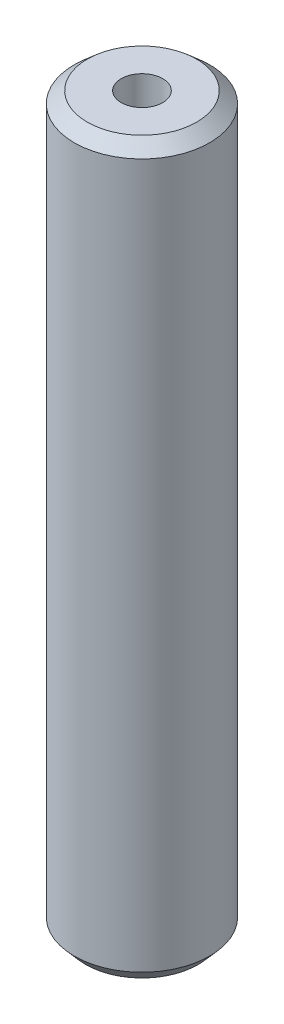
from build123d import *
from OCP.BRepFilletAPI import BRepFilletAPI_MakeChamfer

# Parameters (mm, degrees)
SKETCH1_R           = 20
BOSS_EXTRUDE1_DEPTH = 215.390074645
SKETCH2_R           = 6.141304551
CUT_EXTRUDE1_DEPTH  = 218.239232772
CHAMFER1_SIZE       = 3.356823599
CHAMFER1_SIZE2      = 3.842866654


with BuildPart() as part:
    # Sketch1 → Boss-Extrude1 (new body)
    with BuildSketch(Plane(origin=(0, 0, 0), x_dir=(1, 0, 0), z_dir=(0, 1, 0))):
        Circle(SKETCH1_R)
    extrude(amount=BOSS_EXTRUDE1_DEPTH)

    # Sketch2 → Cut-Extrude1 (cut, through all)
    with BuildSketch(Plane(origin=(0, 0, 0), x_dir=(1, 0, 0), z_dir=(0, 1, 0))):
        Circle(SKETCH2_R)
    extrude(amount=CUT_EXTRUDE1_DEPTH, mode=Mode.SUBTRACT)

    # Chamfer1: one chamfer whose edges measure the first distance from different faces: ONE call of the kernel's chamfer builder (chamfer() names one face for all edges)
    chamfer1_edges_1 = [part.edges().sort_by_distance(p)[0] for p in [
        (-20, 215.390074645, 0),
    ]]
    chamfer1_side_1 = [part.faces().sort_by_distance(p)[0] for p in [
        (-20, 107.695037322, 0),
    ]]
    chamfer1_edges_2 = [part.edges().sort_by_distance(p)[0] for p in [
        (-20, 0, 0),
    ]]
    chamfer1_side_2 = [part.faces().sort_by_distance(p)[0] for p in [
        (-19.434314575, 0, 0),
    ]]
    chamfer1 = BRepFilletAPI_MakeChamfer(part.part.solid().wrapped)
    for e in chamfer1_edges_1:
        chamfer1.Add(CHAMFER1_SIZE, CHAMFER1_SIZE2, e.wrapped, chamfer1_side_1[0].wrapped)  # the first distance lies on this face
    for e in chamfer1_edges_2:
        chamfer1.Add(CHAMFER1_SIZE, CHAMFER1_SIZE2, e.wrapped, chamfer1_side_2[0].wrapped)  # the first distance lies on this face
    add(Compound.cast(chamfer1.Shape()), mode=Mode.REPLACE)


solid = part.part
